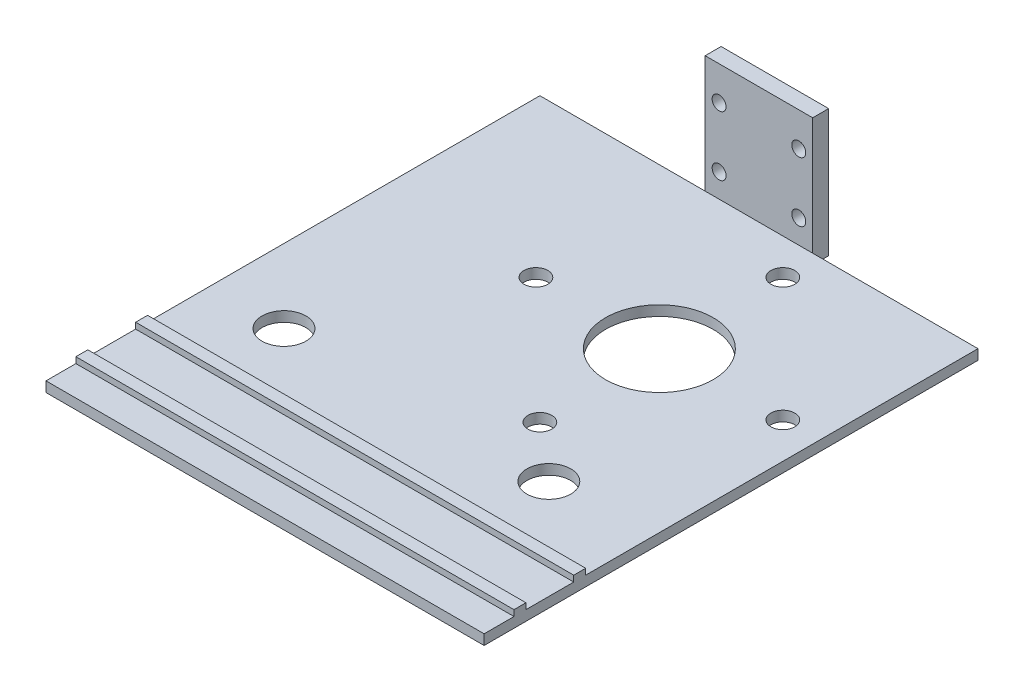
from build123d import *

# Parameters (mm, degrees)
SCHIZZO1_W                        = 27
SCHIZZO1_H                        = 36
ESTRUSIONE_ESTRUSIONE1_DEPTH      = 4
SCHIZZO10_R                       = 1.75
TAGLIO_ESTRUSIONE5_DEPTH          = 10
ESTRUSIONE_ESTRUSIONE2_DEPTH      = 55
ESTRUSIONE_ESTRUSIONE2_DEPTH_BACK = 55
SCHIZZO12_W                       = 124
SCHIZZO12_H                       = 2.549259356
SCHIZZO14_W                       = 3
SCHIZZO14_H                       = 1.5
ESTRUSIONE_ESTRUSIONE3_DEPTH      = 110
SCHIZZO15_W                       = 27
SCHIZZO15_H                       = 4
TAGLIO_ESTRUSIONE6_DEPTH          = 147.165146324
SCHIZZO16_R                       = 13.5
TAGLIO_ESTRUSIONE7_DEPTH          = 41
SCHIZZO17_R                       = 3
TAGLIO_ESTRUSIONE8_DEPTH          = 149.133710291
SCHIZZO18_R                       = 5.5
TAGLIO_ESTRUSIONE9_DEPTH          = 10


with BuildPart() as part:
    # Schizzo1 → Estrusione-Estrusione1 (new body)
    with BuildSketch(Plane.XY):
        with Locations((13.5, -18)):
            Rectangle(SCHIZZO1_W, SCHIZZO1_H)
    extrude(amount=ESTRUSIONE_ESTRUSIONE1_DEPTH)

    # Schizzo10 → Taglio-Estrusione5 (cut)
    with BuildSketch(Plane.XY.offset(4)):
        with Locations((3.5, -12.5)):
            Circle(SCHIZZO10_R)
        with Locations((23.5, -12.5)):
            Circle(SCHIZZO10_R)
        with Locations((23.5, -27.5)):
            Circle(SCHIZZO10_R)
        with Locations((3.5, -27.5)):
            Circle(SCHIZZO10_R)
    extrude(amount=-TAGLIO_ESTRUSIONE5_DEPTH, mode=Mode.SUBTRACT)

    # Schizzo12 → Estrusione-Estrusione2 (add, two sides: drawn at the far end of the back side and taken through both)
    with BuildSketch(Plane(origin=(13.5, 0, 0), x_dir=(0, 0, -1), z_dir=(1, 0, 0)).offset(-ESTRUSIONE_ESTRUSIONE2_DEPTH_BACK)):
        with Locations((-66, -34.725370322)):
            Rectangle(SCHIZZO12_W, SCHIZZO12_H)
    extrude(amount=ESTRUSIONE_ESTRUSIONE2_DEPTH + ESTRUSIONE_ESTRUSIONE2_DEPTH_BACK)

    # Schizzo14 → Estrusione-Estrusione3 (add)
    with BuildSketch(Plane.ZY.offset(41.5)):
        with Locations((104, -32.700740644)):
            Rectangle(SCHIZZO14_W, SCHIZZO14_H)
        with Locations((119, -32.700740644)):
            Rectangle(SCHIZZO14_W, SCHIZZO14_H)
    extrude(amount=-ESTRUSIONE_ESTRUSIONE3_DEPTH)

    # Schizzo15 → Taglio-Estrusione6 (cut, through all)
    with BuildSketch(Plane.XY.offset(4)):
        with Locations((13.5, -2)):
            Rectangle(SCHIZZO15_W, SCHIZZO15_H)
    extrude(amount=-TAGLIO_ESTRUSIONE6_DEPTH, mode=Mode.SUBTRACT)

    # Schizzo16 → Taglio-Estrusione7 (cut)
    with BuildSketch(Plane(origin=(0, -33.450740644, 0), x_dir=(1, 0, 0), z_dir=(0, 1, 0))):
        with Locations((28.5, -44)):
            Circle(SCHIZZO16_R)
    extrude(amount=-TAGLIO_ESTRUSIONE7_DEPTH, mode=Mode.SUBTRACT)

    # Schizzo17 → Taglio-Estrusione8 (cut, through all)
    with BuildSketch(Plane(origin=(0, -33.450740644, 0), x_dir=(1, 0, 0), z_dir=(0, 1, 0))):
        with Locations((28.5, -13)):
            Circle(SCHIZZO17_R)
        with Locations((59.5, -44)):
            Circle(SCHIZZO17_R)
        with Locations((29.5, -75)):
            Circle(SCHIZZO17_R)
        with Locations((-2.5, -44)):
            Circle(SCHIZZO17_R)
    extrude(amount=-TAGLIO_ESTRUSIONE8_DEPTH, mode=Mode.SUBTRACT)

    # Schizzo18 → Taglio-Estrusione9 (cut)
    with BuildSketch(Plane(origin=(0, -33.450740644, 0), x_dir=(1, 0, 0), z_dir=(0, 1, 0))):
        with Locations((43.5, -86.75)):
            Circle(SCHIZZO18_R)
        with Locations((-23, -86.75)):
            Circle(SCHIZZO18_R)
    extrude(amount=-TAGLIO_ESTRUSIONE9_DEPTH, mode=Mode.SUBTRACT)


solid = part.part
